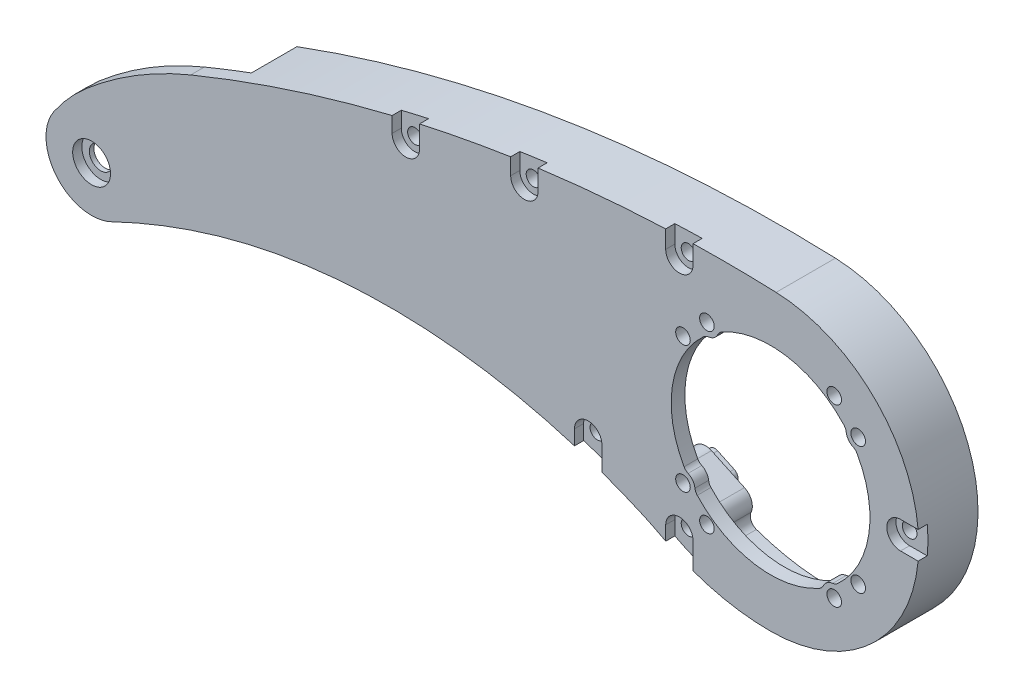
from build123d import *

# Parameters (mm, degrees)
SKETCH_1_R          = 1.6
EXTRUDE_1_DEPTH     = 3
EXTRUDE_START       = 10
SKETCH_2_R          = 1.6
EXTRUDE_2_DEPTH     = 10
EXTRUDE_3_DEPTH     = 2
CUT_EXTRUDE_1_REACH = 164.764
SKETCH_5_R          = 1.6
CUT_EXTRUDE_4_REACH = 164.687
SKETCH_10_R         = 2.5
SKETCH_11_R         = 4.15
CUT_EXTRUDE_5_DEPTH = 2
CUT_EXTRUDE_START   = -2
SKETCH_13_R         = 1.6
CUT_EXTRUDE_6_DEPTH = 2
EXTRUDE_START_2     = 1.5
SKETCH_14_R         = 10
SKETCH_14_R_2       = 7
EXTRUDE_4_DEPTH     = 1.5


with BuildPart() as part:
    # 草图1 → 凸台-拉伸1 (new body)
    with BuildSketch(Plane.XY):
        with BuildLine():
            ThreePointArc((-23.6380873, -26.566491362), (-12.185705724, -30.993964901), (0, -32.5))
            ThreePointArc((0, -32.5), (32.494299771, -0.608672659), (1.217131806, 32.477201083))
            ThreePointArc((1.217131806, 32.477201083), (-64.206902417, 27.922113621), (-127.172269011, 9.580475598))
            ThreePointArc((-127.172269011, 9.580475598), (-139.222290641, 3.45440527), (-150.14384136, -4.511239012))
            ThreePointArc((-150.14384136, -4.511239012), (-153.910924638, -8.201852374), (-157.1671235, -12.350190882))
            ThreePointArc((-157.1671235, -12.350190882), (-156.816374649, -24.130693578), (-145.491863518, -27.395462511))
            ThreePointArc((-145.491863518, -27.395462511), (-145.026167645, -27.212412967), (-144.570211335, -27.006297405))
            ThreePointArc((-144.570211335, -27.006297405), (-136.08176084, -23.223756861), (-127.379272112, -19.963680984))
            ThreePointArc((-127.379272112, -19.963680984), (-77.471346593, -12.811545944), (-28.370763381, -24.26086005))
            ThreePointArc((-28.370763381, -24.26086005), (-25.98221149, -25.368078233), (-23.6380873, -26.566491362))
        make_face()
        with Locations((-13.959899742, -19.214153616)):
            Circle(SKETCH_1_R, mode=Mode.SUBTRACT)
        with Locations((13.959899742, -19.214153616)):
            Circle(SKETCH_1_R, mode=Mode.SUBTRACT)
        with Locations((-19.214153616, -13.959899742)):
            Circle(SKETCH_1_R, mode=Mode.SUBTRACT)
        with Locations((19.214153616, -13.959899742)):
            Circle(SKETCH_1_R, mode=Mode.SUBTRACT)
        with BuildLine():
            ThreePointArc((-10.73941279, 18.971162667), (3.410271338, 21.531605825), (16.076200182, 14.723986814))
            ThreePointArc((16.076200182, 14.723986814), (16.415884227, 14.214206094), (16.585334135, 13.62552251))
            ThreePointArc((16.585334135, 13.62552251), (17.070258581, 12.402268823), (18.083792076, 11.563072091))
            ThreePointArc((18.083792076, 11.563072091), (18.591300533, 11.22000242), (18.971162667, 10.73941279))
            ThreePointArc((18.971162667, 10.73941279), (21.531605825, -3.410271338), (14.723986814, -16.076200182))
            ThreePointArc((14.723986814, -16.076200182), (14.214206094, -16.415884227), (13.62552251, -16.585334135))
            ThreePointArc((13.62552251, -16.585334135), (12.402268823, -17.070258581), (11.563072091, -18.083792076))
            ThreePointArc((11.563072091, -18.083792076), (11.22000242, -18.591300533), (10.73941279, -18.971162667))
            ThreePointArc((10.73941279, -18.971162667), (-3.410271338, -21.531605825), (-16.076200182, -14.723986814))
            ThreePointArc((-16.076200182, -14.723986814), (-16.415884227, -14.214206094), (-16.585334135, -13.62552251))
            ThreePointArc((-16.585334135, -13.62552251), (-17.070258581, -12.402268823), (-18.083792076, -11.563072091))
            ThreePointArc((-18.083792076, -11.563072091), (-18.591300533, -11.22000242), (-18.971162667, -10.73941279))
            ThreePointArc((-18.971162667, -10.73941279), (-21.531605825, 3.410271338), (-14.723986814, 16.076200182))
            ThreePointArc((-14.723986814, 16.076200182), (-14.214206094, 16.415884227), (-13.62552251, 16.585334135))
            ThreePointArc((-13.62552251, 16.585334135), (-12.402268823, 17.070258581), (-11.563072091, 18.083792076))
            ThreePointArc((-11.563072091, 18.083792076), (-11.22000242, 18.591300533), (-10.73941279, 18.971162667))
        make_face(mode=Mode.SUBTRACT)
        with Locations((-19.214153616, 13.959899742)):
            Circle(SKETCH_1_R, mode=Mode.SUBTRACT)
        with Locations((19.214153616, 13.959899742)):
            Circle(SKETCH_1_R, mode=Mode.SUBTRACT)
        with Locations((-13.959899742, 19.214153616)):
            Circle(SKETCH_1_R, mode=Mode.SUBTRACT)
        with Locations((13.959899742, 19.214153616)):
            Circle(SKETCH_1_R, mode=Mode.SUBTRACT)
    extrude(amount=EXTRUDE_1_DEPTH)

    # 草图2 → 凸台-拉伸2 (add)
    with BuildSketch(Plane(origin=(0, 0, 0), x_dir=(-1, 0, 0), z_dir=(0, 0, -1)).offset(EXTRUDE_START)):
        with BuildLine():
            ThreePointArc((17.001102074, 28.618241459), (17.803337861, 26.493729725), (19.86429336, 25.540002931))
            Line((19.86429336, 25.540002931), (27.856104149, 25.178118556))
            ThreePointArc((27.856104149, 25.178118556), (29.994821549, 25.941676183), (30.985784325, 27.98498848))
            ThreePointArc((30.985784325, 27.98498848), (31.663067744, 29.355553639), (33.113908291, 29.837449265))
            ThreePointArc((33.113908291, 29.837449265), (41.227314196, 29.119699609), (49.318671562, 28.185646114))
            ThreePointArc((49.318671562, 28.185646114), (50.642440563, 27.420925697), (51.029255455, 25.941893607))
            ThreePointArc((51.029255455, 25.941893607), (51.587558118, 23.740659748), (53.528225459, 22.561277437))
            Line((53.528225459, 22.561277437), (61.428685658, 21.303211995))
            ThreePointArc((61.428685658, 21.303211995), (63.63968675, 21.821484643), (64.854085448, 23.740434399))
            ThreePointArc((64.854085448, 23.740434399), (65.681160173, 25.026167296), (67.176979656, 25.341897814))
            ThreePointArc((67.176979656, 25.341897814), (71.378861197, 24.513870134), (75.568707204, 23.626949189))
            ThreePointArc((75.568707204, 23.626949189), (76.820720374, 22.749666619), (77.077039123, 21.242529471))
            ThreePointArc((77.077039123, 21.242529471), (77.441191522, 19.000984157), (79.271578812, 17.656806068))
            Line((79.271578812, 17.656806068), (87.032175615, 15.714349565))
            ThreePointArc((87.032175615, 15.714349565), (89.279958958, 16.037772516), (90.657125441, 17.843470399))
            ThreePointArc((90.657125441, 17.843470399), (91.593206584, 19.052153062), (93.11086617, 19.236193992))
            ThreePointArc((93.11086617, 19.236193992), (103.776807204, 16.016684998), (114.31810295, 12.409938501))
            ThreePointArc((114.31810295, 12.409938501), (115.844352177, 12.477074745), (116.877933734, 13.602087253))
            ThreePointArc((116.877933734, 13.602087253), (58.758007498, 28.843357745), (-1.217131806, 32.477201083))
            ThreePointArc((-1.217131806, 32.477201083), (-32.494299771, -0.608672659), (0, -32.5))
            ThreePointArc((0, -32.5), (12.185705724, -30.993964901), (23.6380873, -26.566491362))
            ThreePointArc((23.6380873, -26.566491362), (25.98221149, -25.368078233), (28.370763381, -24.26086005))
            ThreePointArc((28.370763381, -24.26086005), (42.41745626, -18.97671256), (56.959270146, -15.266261857))
            ThreePointArc((56.959270146, -15.266261857), (56.095337342, -13.994443781), (54.584087249, -13.71155818))
            ThreePointArc((54.584087249, -13.71155818), (53.795279647, -13.881664917), (53.007476337, -14.056363738))
            ThreePointArc((53.007476337, -14.056363738), (51.49343256, -13.803829953), (50.585765393, -12.565992248))
            ThreePointArc((50.585765393, -12.565992248), (49.16571342, -10.693278587), (46.831558377, -10.418825857))
            Line((46.831558377, -10.418825857), (39.155257944, -12.671471339))
            ThreePointArc((39.155257944, -12.671471339), (37.339549641, -14.163720453), (37.156649606, -16.506827715))
            ThreePointArc((37.156649606, -16.506827715), (37.061812001, -18.038855032), (35.924321082, -19.069493805))
            ThreePointArc((35.924321082, -19.069493805), (34.270222566, -19.684778141), (32.624096936, -20.321085557))
            ThreePointArc((32.624096936, -20.321085557), (31.089233, -20.303922581), (30.002334443, -19.220062167))
            ThreePointArc((30.002334443, -19.220062167), (28.311680005, -17.587490076), (25.963057786, -17.674540277))
            Line((25.963057786, -17.674540277), (18.723451368, -21.078669963))
            ThreePointArc((18.723451368, -21.078669963), (17.187310183, -22.750078076), (17.261694817, -25.018954835))
            ThreePointArc((17.261694817, -25.018954835), (17.275070203, -26.622295223), (16.106540278, -27.720210117))
            ThreePointArc((16.106540278, -27.720210117), (8.172329404, -29.799953184), (0, -30.5))
            ThreePointArc((0, -30.5), (-19.662506126, -23.315999932), (-30.062360099, -5.148252645))
            ThreePointArc((-30.062360099, -5.148252645), (-29.685338806, -3.685938076), (-28.342105263, -2.995841994))
            ThreePointArc((-28.342105263, -2.995841994), (-25.5, 0), (-28.342105263, 2.995841994))
            ThreePointArc((-28.342105263, 2.995841994), (-29.685338806, 3.685938076), (-30.062360099, 5.148252645))
            ThreePointArc((-30.062360099, 5.148252645), (-20.095728615, 22.943663427), (-1.142231387, 30.478604093))
            ThreePointArc((-1.142231387, 30.478604093), (6.952265997, 30.674453283), (15.049110071, 30.655457646))
            ThreePointArc((15.049110071, 30.655457646), (16.450460044, 30.044409415), (17.001102074, 28.618241459))
        make_face()
        with Locations((20, -23.793522369)):
            Circle(SKETCH_2_R, mode=Mode.SUBTRACT)
        with Locations((-28.5, 0)):
            Circle(SKETCH_2_R, mode=Mode.SUBTRACT)
        with Locations((40, -15.550084001)):
            Circle(SKETCH_2_R, mode=Mode.SUBTRACT)
        with Locations((20, 28.536931977)):
            Circle(SKETCH_2_R, mode=Mode.SUBTRACT)
        with Locations((54, 25.523950011)):
            Circle(SKETCH_2_R, mode=Mode.SUBTRACT)
        with Locations((80, 20.567029869)):
            Circle(SKETCH_2_R, mode=Mode.SUBTRACT)
    extrude(amount=-EXTRUDE_2_DEPTH)

    # 草图4 → 凸台-拉伸3 (add)
    with BuildSketch(Plane(origin=(0, 0, -10), x_dir=(-1, 0, 0), z_dir=(0, 0, -1))):
        with BuildLine():
            Line((27.877880734, -21.746818887), (24.258077525, -23.44888373))
            ThreePointArc((24.258077525, -23.44888373), (22.262377006, -22.729731843), (22.981528893, -20.734031323))
            Line((22.981528893, -20.734031323), (26.601332102, -19.031966481))
            ThreePointArc((26.601332102, -19.031966481), (28.597032621, -19.751118368), (27.877880734, -21.746818887))
        make_face()
        with BuildLine():
            Line((27.92395747, 26.67658308), (23.928052075, 26.857525267))
            ThreePointArc((23.928052075, 26.857525267), (22.497440872, 28.42384311), (24.063758715, 29.854454313))
            Line((24.063758715, 29.854454313), (28.05966411, 29.673512126))
            ThreePointArc((28.05966411, 29.673512126), (29.490275313, 28.107194282), (27.92395747, 26.67658308))
        make_face()
        with BuildLine():
            Line((87.396386209, 17.169461466), (83.516087807, 18.140689717))
            ThreePointArc((83.516087807, 18.140689717), (82.425186501, 19.960012212), (84.244508996, 21.050913518))
            Line((84.244508996, 21.050913518), (88.124807397, 20.079685267))
            ThreePointArc((88.124807397, 20.079685267), (89.215708703, 18.260362772), (87.396386209, 17.169461466))
        make_face()
        with BuildLine():
            Line((48.098671461, -14.73674485), (44.260521244, -15.863067591))
            ThreePointArc((44.260521244, -15.863067591), (42.398843885, -14.846132288), (43.415779189, -12.984454929))
            Line((43.415779189, -12.984454929), (47.253929405, -11.858132188))
            ThreePointArc((47.253929405, -11.858132188), (49.115606764, -12.875067491), (48.098671461, -14.73674485))
        make_face()
        with BuildLine():
            Line((61.664572928, 22.784548282), (57.714342829, 23.413581003))
            ThreePointArc((57.714342829, 23.413581003), (56.468893812, 25.130804561), (58.186117369, 26.376253578))
            Line((58.186117369, 26.376253578), (62.136347469, 25.747220857))
            ThreePointArc((62.136347469, 25.747220857), (63.381796485, 24.029997299), (61.664572928, 22.784548282))
        make_face()
    extrude(amount=EXTRUDE_3_DEPTH)

    # 草图5 → 切除-拉伸1 (cut, up to next)
    with BuildSketch(Plane(origin=(0, 0, -10), x_dir=(-1, 0, 0), z_dir=(0, 0, -1)), mode=Mode.PRIVATE) as cut_extrude_1_sk1:
        with Locations((-28.5, 0)):
            Circle(SKETCH_5_R)
    cut_extrude_1_tool1 = extrude(cut_extrude_1_sk1.sketch, amount=-CUT_EXTRUDE_1_REACH, mode=Mode.PRIVATE) & part.part
    # 草图5 → 切除-拉伸1 (cut, up to next)
    with BuildSketch(Plane(origin=(0, 0, -10), x_dir=(-1, 0, 0), z_dir=(0, 0, -1)), mode=Mode.PRIVATE) as cut_extrude_1_sk2:
        with Locations((54, 25.523950011)):
            Circle(SKETCH_5_R)
    cut_extrude_1_tool2 = extrude(cut_extrude_1_sk2.sketch, amount=-CUT_EXTRUDE_1_REACH, mode=Mode.PRIVATE) & part.part
    # 草图5 → 切除-拉伸1 (cut, up to next)
    with BuildSketch(Plane(origin=(0, 0, -10), x_dir=(-1, 0, 0), z_dir=(0, 0, -1)), mode=Mode.PRIVATE) as cut_extrude_1_sk3:
        with Locations((80, 20.567029869)):
            Circle(SKETCH_5_R)
    cut_extrude_1_tool3 = extrude(cut_extrude_1_sk3.sketch, amount=-CUT_EXTRUDE_1_REACH, mode=Mode.PRIVATE) & part.part
    # 草图5 → 切除-拉伸1 (cut, up to next)
    with BuildSketch(Plane(origin=(0, 0, -10), x_dir=(-1, 0, 0), z_dir=(0, 0, -1)), mode=Mode.PRIVATE) as cut_extrude_1_sk4:
        with Locations((40, -15.550084001)):
            Circle(SKETCH_5_R)
    cut_extrude_1_tool4 = extrude(cut_extrude_1_sk4.sketch, amount=-CUT_EXTRUDE_1_REACH, mode=Mode.PRIVATE) & part.part
    # 草图5 → 切除-拉伸1 (cut, up to next)
    with BuildSketch(Plane(origin=(0, 0, -10), x_dir=(-1, 0, 0), z_dir=(0, 0, -1)), mode=Mode.PRIVATE) as cut_extrude_1_sk5:
        with Locations((20, -23.793522369)):
            Circle(SKETCH_5_R)
    cut_extrude_1_tool5 = extrude(cut_extrude_1_sk5.sketch, amount=-CUT_EXTRUDE_1_REACH, mode=Mode.PRIVATE) & part.part
    # 草图5 → 切除-拉伸1 (cut, up to next)
    with BuildSketch(Plane(origin=(0, 0, -10), x_dir=(-1, 0, 0), z_dir=(0, 0, -1)), mode=Mode.PRIVATE) as cut_extrude_1_sk6:
        with Locations((20, 28.536931977)):
            Circle(SKETCH_5_R)
    cut_extrude_1_tool6 = extrude(cut_extrude_1_sk6.sketch, amount=-CUT_EXTRUDE_1_REACH, mode=Mode.PRIVATE) & part.part
    add(cut_extrude_1_tool1.solids().sort_by_distance((28.5, 0, -10))[0], mode=Mode.SUBTRACT)
    add(cut_extrude_1_tool2.solids().sort_by_distance((-54, 25.52395, -10))[0], mode=Mode.SUBTRACT)
    add(cut_extrude_1_tool3.solids().sort_by_distance((-80, 20.56703, -10))[0], mode=Mode.SUBTRACT)
    add(cut_extrude_1_tool4.solids().sort_by_distance((-40, -15.550084, -10))[0], mode=Mode.SUBTRACT)
    add(cut_extrude_1_tool5.solids().sort_by_distance((-20, -23.793522, -10))[0], mode=Mode.SUBTRACT)
    add(cut_extrude_1_tool6.solids().sort_by_distance((-20, 28.536932, -10))[0], mode=Mode.SUBTRACT)

    # 草图10 → 切除-拉伸4 (cut, up to next)
    with BuildSketch(Plane(origin=(0, 0, 0), x_dir=(-1, 0, 0), z_dir=(0, 0, -1)), mode=Mode.PRIVATE) as cut_extrude_4_sk1:
        with Locations((148.916083752, -18)):
            Circle(SKETCH_10_R)
    cut_extrude_4_tool1 = extrude(cut_extrude_4_sk1.sketch, amount=-CUT_EXTRUDE_4_REACH, mode=Mode.PRIVATE) & part.part
    add(cut_extrude_4_tool1.solids().sort_by_distance((-148.916084, -18, 0))[0], mode=Mode.SUBTRACT)

    # 草图11 → 切除-拉伸5 (cut)
    with BuildSketch(Plane.XY.offset(3)):
        with Locations((-148.916083752, -18)):
            Circle(SKETCH_11_R)
    extrude(amount=-CUT_EXTRUDE_5_DEPTH, mode=Mode.SUBTRACT)

    # 草图13 → 切除-拉伸6 (cut)
    # profile 1 of 6: a face of its own
    with BuildSketch(Plane.XY.offset(3).offset(CUT_EXTRUDE_START)):
        with BuildLine():
            ThreePointArc((-43, -18.79486084), (-39.988341619, -19.766013748), (-37, -20.806705127))
            Line((-37, -20.806705127), (-37, -15.550084001))
            ThreePointArc((-37, -15.550084001), (-40, -12.550084001), (-43, -15.550084001))
            Line((-43, -15.550084001), (-43, -18.79486084))
        make_face()
        with Locations((-40, -15.550084001)):
            Circle(SKETCH_13_R, mode=Mode.SUBTRACT)
    # profile 2 of 6: a face of its own
    with BuildSketch(Plane.XY.offset(3).offset(CUT_EXTRUDE_START)):
        with BuildLine():
            ThreePointArc((-23, -26.902477601), (-20.04292434, -28.311736195), (-17, -29.524550153))
            Line((-17, -29.524550153), (-17, -23.793522369))
            ThreePointArc((-17, -23.793522369), (-20, -20.793522369), (-23, -23.793522369))
            Line((-23, -23.793522369), (-23, -26.902477601))
        make_face()
        with Locations((-20, -23.793522369)):
            Circle(SKETCH_13_R, mode=Mode.SUBTRACT)
    # profile 3 of 6: a face of its own
    with BuildSketch(Plane.XY.offset(3).offset(CUT_EXTRUDE_START)):
        with BuildLine():
            ThreePointArc((32.361242251, -3), (32.5, 0), (32.361242251, 3))
            Line((32.361242251, 3), (28.5, 3))
            ThreePointArc((28.5, 3), (25.5, 0), (28.5, -3))
            Line((28.5, -3), (32.361242251, -3))
        make_face()
        with Locations((28.5, 0)):
            Circle(SKETCH_13_R, mode=Mode.SUBTRACT)
    # profile 4 of 6: a face of its own
    with BuildSketch(Plane.XY.offset(3).offset(CUT_EXTRUDE_START)):
        with BuildLine():
            ThreePointArc((-17, 32.619234927), (-20.000463964, 32.53894641), (-23, 32.429338848))
            Line((-23, 32.429338848), (-23, 28.536931977))
            ThreePointArc((-23, 28.536931977), (-20, 25.536931977), (-17, 28.536931977))
            Line((-17, 28.536931977), (-17, 32.619234927))
        make_face()
        with Locations((-20, 28.536931977)):
            Circle(SKETCH_13_R, mode=Mode.SUBTRACT)
    # profile 5 of 6: a face of its own
    with BuildSketch(Plane.XY.offset(3).offset(CUT_EXTRUDE_START)):
        with BuildLine():
            ThreePointArc((-51, 29.981954991), (-54.002128749, 29.565339979), (-57, 29.119119123))
            Line((-57, 29.119119123), (-57, 25.523950011))
            ThreePointArc((-57, 25.523950011), (-54, 22.523950011), (-51, 25.523950011))
            Line((-51, 25.523950011), (-51, 29.981954991))
        make_face()
        with Locations((-54, 25.523950011)):
            Circle(SKETCH_13_R, mode=Mode.SUBTRACT)
    # profile 6 of 6: a face of its own
    with BuildSketch(Plane.XY.offset(3).offset(CUT_EXTRUDE_START)):
        with BuildLine():
            Line((-83, 23.960592486), (-83, 20.567029869))
            ThreePointArc((-83, 20.567029869), (-80, 17.567029869), (-77, 20.567029869))
            Line((-77, 20.567029869), (-77, 25.359108824))
            ThreePointArc((-77, 25.359108824), (-80.003506771, 24.674895616), (-83, 23.960592486))
        make_face()
        with Locations((-80, 20.567029869)):
            Circle(SKETCH_13_R, mode=Mode.SUBTRACT)
    extrude(amount=CUT_EXTRUDE_6_DEPTH, mode=Mode.SUBTRACT)

    # 草图14 → 凸台-拉伸4 (add)
    with BuildSketch(Plane(origin=(0, 0, 0), x_dir=(-1, 0, 0), z_dir=(0, 0, -1)).offset(EXTRUDE_START_2)):
        with Locations((148.916083752, -18)):
            Circle(SKETCH_14_R)
        with Locations((148.916083752, -18)):
            Circle(SKETCH_14_R_2, mode=Mode.SUBTRACT)
    extrude(amount=-EXTRUDE_4_DEPTH)


solid = part.part
